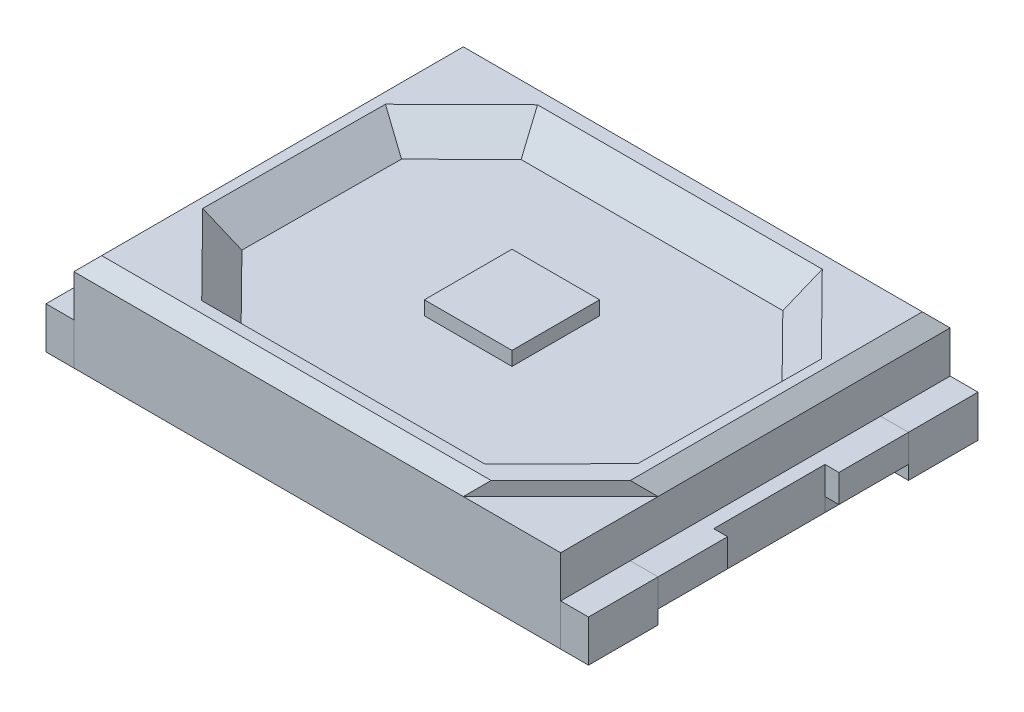
from build123d import *

# Parameters (mm, degrees)
SKETCH8_W             = 3.5
SKETCH8_H             = 2.8
BOSS_EXTRUDE3_DEPTH   = 0.7
CUT_EXTRUDE2_DEPTH    = 0.2
CHAMFER1_SIZE         = 0.1
CUT_EXTRUDE3_DEPTH    = 0.1
SKETCH12_W            = 0.200076611
SKETCH12_H            = 0.5
BOSS_EXTRUDE4_DEPTH   = 0.3
BOSS_EXTRUDE4_2_DEPTH = 0.3
BOSS_EXTRUDE4_3_DEPTH = 0.3
BOSS_EXTRUDE4_4_DEPTH = 0.3
BOSS_EXTRUDE8_DEPTH   = 0.3
BOSS_EXTRUDE8_2_DEPTH = 0.3
SKETCH15_W            = 0.6
SKETCH15_H            = 0.723719119
SKETCH15_R            = 0.236799963
CUT_EXTRUDE12_DEPTH   = 0.1
CHAMFER5_SIZE         = 0.2
SKETCH25_W            = 0.63
SKETCH25_H            = 0.63
BOSS_EXTRUDE13_DEPTH  = 0.1
SKETCH27_W            = 0.5
SKETCH27_H            = 0.1
CUT_EXTRUDE25_DEPTH   = 0.1
SKETCH30_W            = 0.5
SKETCH30_H            = 0.1
CUT_EXTRUDE26_DEPTH   = 0.1
SKETCH31_W            = 0.5
SKETCH31_H            = 0.1
CUT_EXTRUDE27_DEPTH   = 0.1
SKETCH32_W            = 0.5
SKETCH32_H            = 0.1
CUT_EXTRUDE28_DEPTH   = 0.1


with BuildPart() as part:
    # Sketch8 → Boss-Extrude3 (new body)
    with BuildSketch(Plane(origin=(0, 0, 0), x_dir=(1, 0, 0), z_dir=(0, 1, 0))):
        Rectangle(SKETCH8_W, SKETCH8_H)
    extrude(amount=-BOSS_EXTRUDE3_DEPTH)

    # Sketch9 → Cut-Extrude2 (cut)
    with BuildSketch(Plane(origin=(0, 0, 0), x_dir=(1, 0, 0), z_dir=(0, 1, 0))):
        Polygon((-1.022435057, 1.205886324), (-1.572389449, 0.66264326), (-1.580406785, -0.6432877), (-1.010176789, -1.220562425), (1.024673791, -1.220562425), (1.572357881, -0.667785303), (1.580406785, 0.6432877), (1.024673791, 1.205886324), align=None)
    extrude(amount=-CUT_EXTRUDE2_DEPTH, mode=Mode.SUBTRACT)

    # Chamfer1
    chamfer1_edges = [part.edges().sort_by_distance(p)[0] for p in [
        (-1.75, 0, 0),
        (0, 0, -1.4),
        (1.75, 0, 0),
        (0, 0, 1.4),
    ]]
    chamfer(chamfer1_edges, length=CHAMFER1_SIZE)

    # Sketch10 → Cut-Extrude3 (cut)
    with BuildSketch(Plane(origin=(0, 0, 0), x_dir=(1, 0, 0), z_dir=(0, 1, 0))):
        Polygon((1.75, -0.7), (1.05, -1.4), (1.75, -1.4), align=None)
    extrude(amount=-CUT_EXTRUDE3_DEPTH, mode=Mode.SUBTRACT)

    # Sketch15 → Cut-Extrude12 (cut)
    # profile 1 of 4: a face of its own
    with BuildSketch(Plane.XZ.offset(0.7)):
        with BuildLine():
            Line((1.75, -0.9), (1.75, 0.9))
            Line((1.75, 0.9), (0.759841575, 0.9))
            ThreePointArc((0.759841575, 0.9), (0.632478155, 0.592517505), (0.32499566, 0.465154085))
            Line((0.32499566, 0.465154085), (-0.117527877, 0.465154085))
            ThreePointArc((-0.117527877, 0.465154085), (-0.188238555, 0.435864763), (-0.217527877, 0.365154085))
            Line((-0.217527877, 0.365154085), (-0.217527877, -0.365154085))
            ThreePointArc((-0.217527877, -0.365154085), (-0.188238555, -0.435864763), (-0.117527877, -0.465154085))
            Line((-0.117527877, -0.465154085), (0.32499566, -0.465154085))
            ThreePointArc((0.32499566, -0.465154085), (0.632478155, -0.592517505), (0.759841575, -0.9))
            Line((0.759841575, -0.9), (1.75, -0.9))
        make_face()
    # profile 2 of 4: a face of its own
    with BuildSketch(Plane.XZ.offset(0.7)):
        with BuildLine():
            Line((-1.392928117, 0.9), (-1.75, 0.9))
            Line((-1.75, 0.9), (-1.75, -0.9))
            Line((-1.75, -0.9), (-1.392928117, -0.9))
            Line((-1.392928117, -0.9), (-1.392928117, -0.8))
            ThreePointArc((-1.392928117, -0.8), (-1.252278886, -0.479083743), (-0.920984108, -0.365008244))
            ThreePointArc((-0.920984108, -0.365008244), (-0.853788556, -0.333929517), (-0.826382909, -0.265154085))
            Line((-0.826382909, -0.265154085), (-0.826382909, 0.365154085))
            ThreePointArc((-0.826382909, 0.365154085), (-0.853788556, 0.433929517), (-0.920984108, 0.465008244))
            ThreePointArc((-0.920984108, 0.465008244), (-1.252278886, 0.579083743), (-1.392928117, 0.9))
        make_face()
    # profile 3 of 4: a face of its own
    with BuildSketch(Plane.XZ.offset(0.7)):
        with Locations((-0.526382909, -1.027603704)):
            Rectangle(SKETCH15_W, SKETCH15_H)
        with Locations(Location((-0.526382909, -1.027603704, 0), (0, 0, 270))):
            Circle(SKETCH15_R, mode=Mode.SUBTRACT)
    # profile 4 of 4: a face of its own
    with BuildSketch(Plane.XZ.offset(0.7)):
        with Locations((-0.526382909, 1.027603704)):
            Rectangle(SKETCH15_W, SKETCH15_H)
        with Locations(Location((-0.526382909, 1.027603704, 0), (0, 0, 270))):
            Circle(SKETCH15_R, mode=Mode.SUBTRACT)
    extrude(amount=-CUT_EXTRUDE12_DEPTH, mode=Mode.SUBTRACT)

    # Chamfer5
    chamfer5_edges = [part.edges().sort_by_distance(p)[0] for p in [
        (1.302540288, -0.2, -0.924587012),
        (1.576382333, -0.2, 0.012248802),
        (1.298515836, -0.2, 0.944173864),
        (0.007248501, -0.2, 1.220562425),
        (-1.295291787, -0.2, 0.931925062),
        (-1.576398117, -0.2, -0.00967778),
        (-1.297412253, -0.2, -0.934264792),
        (0.001119367, -0.2, -1.205886324),
    ]]
    chamfer(chamfer5_edges, length=CHAMFER5_SIZE - 0.0001)  # a hair under: the kernel refuses the full size

    # Sketch25 → Boss-Extrude13 (add)
    with BuildSketch(Plane(origin=(0, -0.2, 0), x_dir=(1, 0, 0), z_dir=(0, 1, 0))):
        Rectangle(SKETCH25_W, SKETCH25_H)
    extrude(amount=BOSS_EXTRUDE13_DEPTH)


with BuildPart() as body_2:
    # Sketch12 → Boss-Extrude4 (new body)
    with BuildSketch(Plane.XZ.offset(0.7)):
        with Locations((-1.850038306, -1.15)):
            Rectangle(SKETCH12_W, SKETCH12_H)
    extrude(amount=-BOSS_EXTRUDE4_DEPTH)


with BuildPart() as body_3:
    # Sketch12 → Boss-Extrude4 2 (new body)
    with BuildSketch(Plane.XZ.offset(0.7)):
        with Locations((-1.850038306, 1.15)):
            Rectangle(SKETCH12_W, SKETCH12_H)
    extrude(amount=-BOSS_EXTRUDE4_2_DEPTH)


with BuildPart() as body_4:
    # Sketch12 → Boss-Extrude4 3 (new body)
    with BuildSketch(Plane.XZ.offset(0.7)):
        with Locations((1.850038306, 1.15)):
            Rectangle(SKETCH12_W, SKETCH12_H)
    extrude(amount=-BOSS_EXTRUDE4_3_DEPTH)


with BuildPart() as body_5:
    # Sketch12 → Boss-Extrude4 4 (new body)
    with BuildSketch(Plane.XZ.offset(0.7)):
        with Locations((1.850038306, -1.15)):
            Rectangle(SKETCH12_W, SKETCH12_H)
    extrude(amount=-BOSS_EXTRUDE4_4_DEPTH)


with BuildPart() as body_6:
    # Sketch13 → Boss-Extrude8 (new body)
    with BuildSketch(Plane.XZ.offset(0.7)):
        Polygon((1.950076611, 0.9), (1.75, 0.9), (1.75, 0.4), (1.75, -0.4), (1.75, -0.9), (1.950076611, -0.9), (1.950076611, -0.4), (1.850038305, -0.4), (1.850038305, 0.4), (1.950076611, 0.4), align=None)
    extrude(amount=-BOSS_EXTRUDE8_DEPTH)

    # Sketch27 → Cut-Extrude25 (cut)
    with BuildSketch(Plane(origin=(1.950076611, 0, 0), x_dir=(0, 0, -1), z_dir=(1, 0, 0))):
        with Locations((0.65, -0.65)):
            Rectangle(SKETCH27_W, SKETCH27_H)
    extrude(amount=-CUT_EXTRUDE25_DEPTH, mode=Mode.SUBTRACT)

    # Sketch30 → Cut-Extrude26 (cut)
    with BuildSketch(Plane(origin=(1.950076611, 0, 0), x_dir=(0, 0, -1), z_dir=(1, 0, 0))):
        with Locations((-0.65, -0.65)):
            Rectangle(SKETCH30_W, SKETCH30_H)
    extrude(amount=-CUT_EXTRUDE26_DEPTH, mode=Mode.SUBTRACT)


with BuildPart() as body_7:
    # Sketch13 → Boss-Extrude8 2 (new body)
    with BuildSketch(Plane.XZ.offset(0.7)):
        Polygon((-1.75, -0.9), (-1.75, -0.4), (-1.75, 0.4), (-1.75, 0.9), (-1.950076611, 0.9), (-1.950076611, 0.4), (-1.850038305, 0.4), (-1.850038305, -0.4), (-1.950076611, -0.4), (-1.950076611, -0.9), align=None)
    extrude(amount=-BOSS_EXTRUDE8_2_DEPTH)

    # Sketch31 → Cut-Extrude27 (cut)
    with BuildSketch(Plane.ZY.offset(1.950076611)):
        with Locations((-0.65, -0.65)):
            Rectangle(SKETCH31_W, SKETCH31_H)
    extrude(amount=-CUT_EXTRUDE27_DEPTH, mode=Mode.SUBTRACT)

    # Sketch32 → Cut-Extrude28 (cut)
    with BuildSketch(Plane.ZY.offset(1.950076611)):
        with Locations((0.65, -0.65)):
            Rectangle(SKETCH32_W, SKETCH32_H)
    extrude(amount=-CUT_EXTRUDE28_DEPTH, mode=Mode.SUBTRACT)


solid = Compound([part.part, body_2.part, body_3.part, body_4.part, body_5.part, body_6.part, body_7.part])
